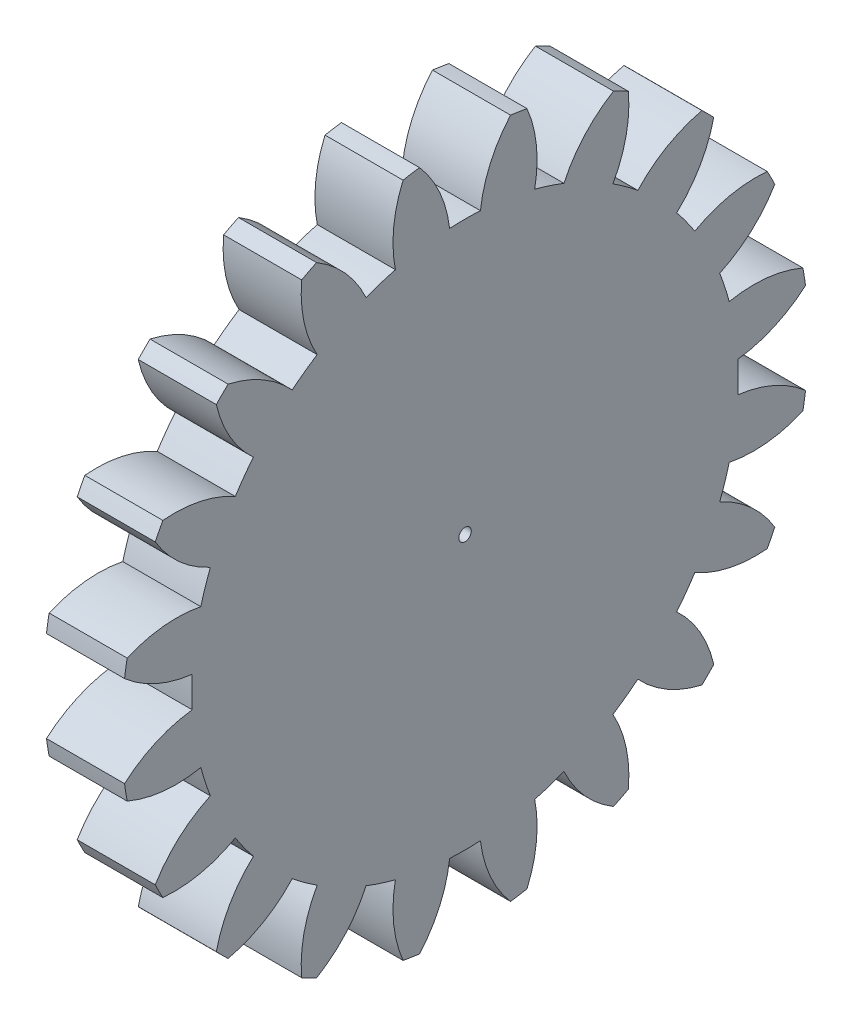
from build123d import *

# Parameters (mm, degrees)
BASPROSKE_W     = 5
BASPROSKE_H     = 22
TOOTHCUT_DEPTH  = 32.511902513
TEETHCUTS_COUNT = 20
TEETHCUTS_ANGLE = 342
BORSKE_R        = 0.4
BORE_DEPTH      = 50.0000508


with BuildPart() as part:
    # BasProSke → Base-Revolve (revolve)
    with BuildSketch(Plane(origin=(0, 0, 0), x_dir=(1, 0, 0), z_dir=(0, 1, 0))):
        with Locations((2.5, 11)):
            Rectangle(BASPROSKE_W, BASPROSKE_H)
    revolve(axis=Axis((-10, 0, 0), (1, 0, 0)))

    # TooCutSke → ToothCut (cut, through all)
    with BuildSketch(Plane(origin=(0, 0, 0), x_dir=(0, 0, -1), z_dir=(1, 0, 0))):
        with BuildLine():
            ThreePointArc((0.986171591, 17.471189616), (0, 17.499), (-0.986171591, 17.471189616))
            ThreePointArc((-0.986171591, 17.471189616), (-1.626916196, 19.798789858), (-2.932850173, 21.829260982))
            ThreePointArc((-2.932850173, 21.829260982), (0, 22.0254), (2.932850173, 21.829260982))
            ThreePointArc((2.932850173, 21.829260982), (1.626916196, 19.798789858), (0.986171591, 17.471189616))
        make_face()
    toothcut = extrude(amount=TOOTHCUT_DEPTH, mode=Mode.SUBTRACT)

    # TeethCuts: ToothCut ×20 about axis
    teethcuts_axis = Axis((-10, 0, 0), (1, 0, 0))
    for i in range(1, TEETHCUTS_COUNT):
        add(toothcut.rotate(teethcuts_axis, i * TEETHCUTS_ANGLE / (TEETHCUTS_COUNT - 1)), mode=Mode.SUBTRACT)

    # BorSke → Bore (cut, symmetric)
    with BuildSketch(Plane(origin=(0, 0, 0), x_dir=(0, 0, -1), z_dir=(1, 0, 0))):
        Circle(BORSKE_R)
    extrude(amount=BORE_DEPTH, both=True, mode=Mode.SUBTRACT)


solid = part.part
